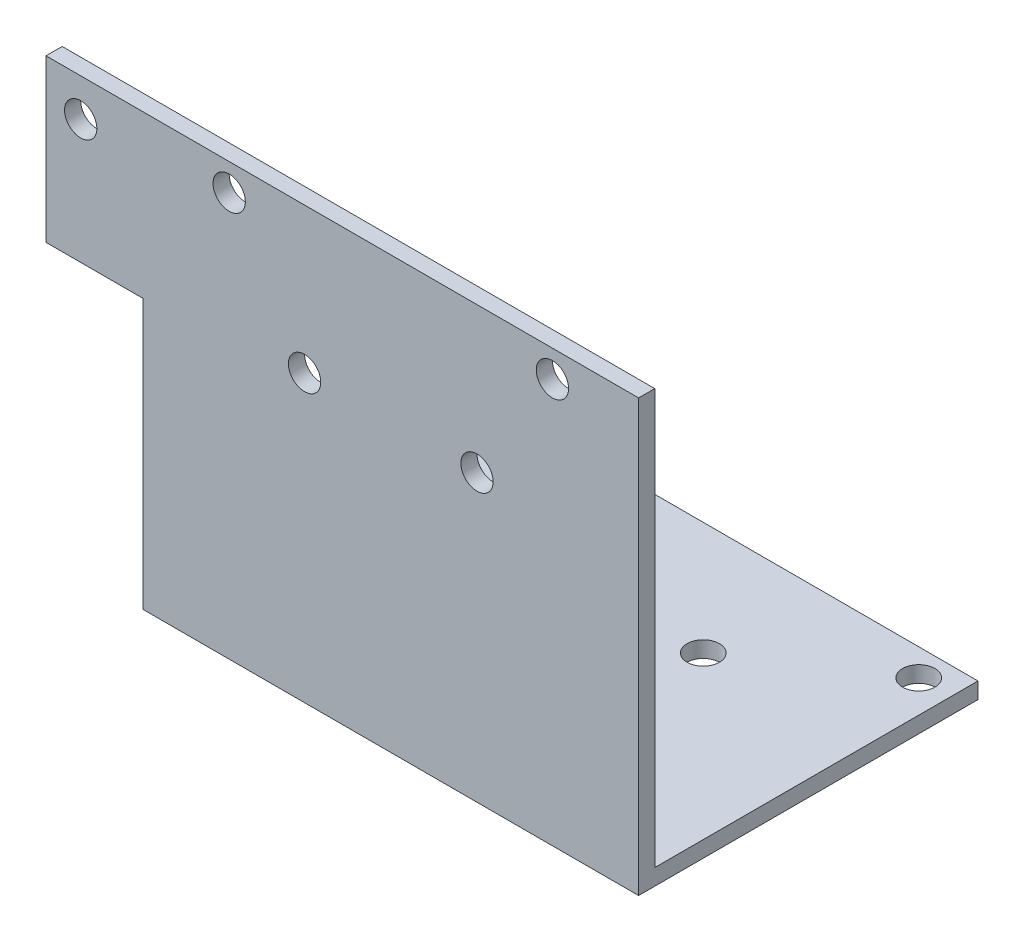
from build123d import *

# Parameters (mm, degrees)
SKETCH_1_W          = 46
SKETCH_1_H          = 40
EXTRUDE_1_DEPTH     = 1.5
SKETCH_2_W          = 46
SKETCH_2_H          = 1.5
EXTRUDE_2_DEPTH     = 30
CUT_EXTRUDE_1_REACH = 55.956
SKETCH_3_R          = 1.5
CUT_EXTRUDE_2_REACH = 45.832
SKETCH_4_R          = 1.5
SKETCH_5_W          = 9
SKETCH_5_H          = 15
SKETCH_5_R          = 1.5
EXTRUDE_3_DEPTH     = 1.5


with BuildPart() as part:
    # Эскиз1 → Бобышка-Вытянуть1 (new body)
    with BuildSketch(Plane.XY):
        Rectangle(SKETCH_1_W, SKETCH_1_H)
    extrude(amount=EXTRUDE_1_DEPTH)

    # Эскиз2 → Бобышка-Вытянуть2 (add)
    with BuildSketch(Plane(origin=(0, 0, 0), x_dir=(-1, 0, 0), z_dir=(0, 0, -1))):
        with Locations((0, -19.25)):
            Rectangle(SKETCH_2_W, SKETCH_2_H)
    extrude(amount=EXTRUDE_2_DEPTH)

    # Эскиз3 → Вырез-Вытянуть1 (cut, up to next)
    with BuildSketch(Plane(origin=(0, -18.5, 0), x_dir=(1, 0, 0), z_dir=(0, 1, 0)), mode=Mode.PRIVATE) as cut_extrude_1_sk1:
        with Locations((-8, 19.5)):
            Circle(SKETCH_3_R)
    cut_extrude_1_tool1 = extrude(cut_extrude_1_sk1.sketch, amount=-CUT_EXTRUDE_1_REACH, mode=Mode.PRIVATE) & part.part
    # Эскиз3 → Вырез-Вытянуть1 (cut, up to next)
    with BuildSketch(Plane(origin=(0, -18.5, 0), x_dir=(1, 0, 0), z_dir=(0, 1, 0)), mode=Mode.PRIVATE) as cut_extrude_1_sk2:
        with Locations((8, 19.5)):
            Circle(SKETCH_3_R)
    cut_extrude_1_tool2 = extrude(cut_extrude_1_sk2.sketch, amount=-CUT_EXTRUDE_1_REACH, mode=Mode.PRIVATE) & part.part
    # Эскиз3 → Вырез-Вытянуть1 (cut, up to next)
    with BuildSketch(Plane(origin=(0, -18.5, 0), x_dir=(1, 0, 0), z_dir=(0, 1, 0)), mode=Mode.PRIVATE) as cut_extrude_1_sk3:
        with Locations((-8, 4.5)):
            Circle(SKETCH_3_R)
    cut_extrude_1_tool3 = extrude(cut_extrude_1_sk3.sketch, amount=-CUT_EXTRUDE_1_REACH, mode=Mode.PRIVATE) & part.part
    # Эскиз3 → Вырез-Вытянуть1 (cut, up to next)
    with BuildSketch(Plane(origin=(0, -18.5, 0), x_dir=(1, 0, 0), z_dir=(0, 1, 0)), mode=Mode.PRIVATE) as cut_extrude_1_sk4:
        with Locations((8, 4.5)):
            Circle(SKETCH_3_R)
    cut_extrude_1_tool4 = extrude(cut_extrude_1_sk4.sketch, amount=-CUT_EXTRUDE_1_REACH, mode=Mode.PRIVATE) & part.part
    # Эскиз3 → Вырез-Вытянуть1 (cut, up to next)
    with BuildSketch(Plane(origin=(0, -18.5, 0), x_dir=(1, 0, 0), z_dir=(0, 1, 0)), mode=Mode.PRIVATE) as cut_extrude_1_sk5:
        with Locations((-20, 27.5)):
            Circle(SKETCH_3_R)
    cut_extrude_1_tool5 = extrude(cut_extrude_1_sk5.sketch, amount=-CUT_EXTRUDE_1_REACH, mode=Mode.PRIVATE) & part.part
    # Эскиз3 → Вырез-Вытянуть1 (cut, up to next)
    with BuildSketch(Plane(origin=(0, -18.5, 0), x_dir=(1, 0, 0), z_dir=(0, 1, 0)), mode=Mode.PRIVATE) as cut_extrude_1_sk6:
        with Locations((20, 27.5)):
            Circle(SKETCH_3_R)
    cut_extrude_1_tool6 = extrude(cut_extrude_1_sk6.sketch, amount=-CUT_EXTRUDE_1_REACH, mode=Mode.PRIVATE) & part.part
    add(cut_extrude_1_tool1.solids().sort_by_distance((-8, -18.5, -19.5))[0], mode=Mode.SUBTRACT)
    add(cut_extrude_1_tool2.solids().sort_by_distance((8, -18.5, -19.5))[0], mode=Mode.SUBTRACT)
    add(cut_extrude_1_tool3.solids().sort_by_distance((-8, -18.5, -4.5))[0], mode=Mode.SUBTRACT)
    add(cut_extrude_1_tool4.solids().sort_by_distance((8, -18.5, -4.5))[0], mode=Mode.SUBTRACT)
    add(cut_extrude_1_tool5.solids().sort_by_distance((-20, -18.5, -27.5))[0], mode=Mode.SUBTRACT)
    add(cut_extrude_1_tool6.solids().sort_by_distance((20, -18.5, -27.5))[0], mode=Mode.SUBTRACT)

    # Эскиз4 → Вырез-Вытянуть2 (cut, up to next)
    with BuildSketch(Plane.XY.offset(1.5), mode=Mode.PRIVATE) as cut_extrude_2_sk1:
        with Locations((-15, 17.5)):
            Circle(SKETCH_4_R)
    cut_extrude_2_tool1 = extrude(cut_extrude_2_sk1.sketch, amount=-CUT_EXTRUDE_2_REACH, mode=Mode.PRIVATE) & part.part
    # Эскиз4 → Вырез-Вытянуть2 (cut, up to next)
    with BuildSketch(Plane.XY.offset(1.5), mode=Mode.PRIVATE) as cut_extrude_2_sk2:
        with Locations((15, 17.5)):
            Circle(SKETCH_4_R)
    cut_extrude_2_tool2 = extrude(cut_extrude_2_sk2.sketch, amount=-CUT_EXTRUDE_2_REACH, mode=Mode.PRIVATE) & part.part
    # Эскиз4 → Вырез-Вытянуть2 (cut, up to next)
    with BuildSketch(Plane.XY.offset(1.5), mode=Mode.PRIVATE) as cut_extrude_2_sk3:
        with Locations((-8, 6.5)):
            Circle(SKETCH_4_R)
    cut_extrude_2_tool3 = extrude(cut_extrude_2_sk3.sketch, amount=-CUT_EXTRUDE_2_REACH, mode=Mode.PRIVATE) & part.part
    # Эскиз4 → Вырез-Вытянуть2 (cut, up to next)
    with BuildSketch(Plane.XY.offset(1.5), mode=Mode.PRIVATE) as cut_extrude_2_sk4:
        with Locations((8, 6.5)):
            Circle(SKETCH_4_R)
    cut_extrude_2_tool4 = extrude(cut_extrude_2_sk4.sketch, amount=-CUT_EXTRUDE_2_REACH, mode=Mode.PRIVATE) & part.part
    add(cut_extrude_2_tool1.solids().sort_by_distance((-15, 17.5, 1.5))[0], mode=Mode.SUBTRACT)
    add(cut_extrude_2_tool2.solids().sort_by_distance((15, 17.5, 1.5))[0], mode=Mode.SUBTRACT)
    add(cut_extrude_2_tool3.solids().sort_by_distance((-8, 6.5, 1.5))[0], mode=Mode.SUBTRACT)
    add(cut_extrude_2_tool4.solids().sort_by_distance((8, 6.5, 1.5))[0], mode=Mode.SUBTRACT)

    # Эскиз5 → Бобышка-Вытянуть3 (add)
    with BuildSketch(Plane(origin=(0, 0, 0), x_dir=(-1, 0, 0), z_dir=(0, 0, -1))):
        with Locations((27.5, 12.5)):
            Rectangle(SKETCH_5_W, SKETCH_5_H)
        with Locations((28.78, 16.5)):
            Circle(SKETCH_5_R, mode=Mode.SUBTRACT)
    extrude(amount=-EXTRUDE_3_DEPTH)


solid = part.part
